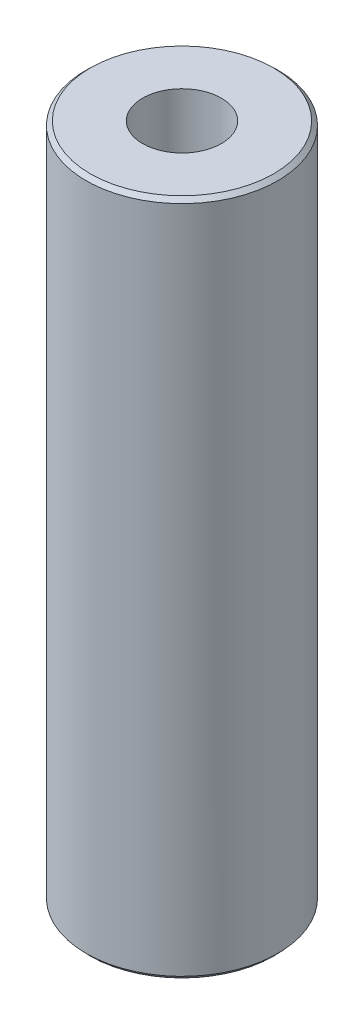
from build123d import *
from OCP.BRepFilletAPI import BRepFilletAPI_MakeChamfer

# Parameters (mm, degrees)
SKETCH1_R           = 45
BOSS_EXTRUDE1_DEPTH = 317.914214539
SKETCH2_R           = 18.498550356
CUT_EXTRUDE1_DEPTH  = 325.221294498
CHAMFER1_SIZE       = 1.83476939
CHAMFER1_SIZE2      = 1.957683998


with BuildPart() as part:
    # Sketch1 → Boss-Extrude1 (new body)
    with BuildSketch(Plane(origin=(0, 0, 0), x_dir=(1, 0, 0), z_dir=(0, 1, 0))):
        Circle(SKETCH1_R)
    extrude(amount=BOSS_EXTRUDE1_DEPTH)

    # Sketch2 → Cut-Extrude1 (cut, through all)
    with BuildSketch(Plane(origin=(0, 0, 0), x_dir=(1, 0, 0), z_dir=(0, 1, 0))):
        Circle(SKETCH2_R)
    extrude(amount=CUT_EXTRUDE1_DEPTH, mode=Mode.SUBTRACT)

    # Chamfer1: one chamfer whose edges measure the first distance from different faces: ONE call of the kernel's chamfer builder (chamfer() names one face for all edges)
    chamfer1_edges_1 = [part.edges().sort_by_distance(p)[0] for p in [
        (-45, 317.914214539, 0),
    ]]
    chamfer1_side_1 = [part.faces().sort_by_distance(p)[0] for p in [
        (-45, 158.957107269, 0),
    ]]
    chamfer1_edges_2 = [part.edges().sort_by_distance(p)[0] for p in [
        (-45, 0, 0),
    ]]
    chamfer1_side_2 = [part.faces().sort_by_distance(p)[0] for p in [
        (-43.727207794, 0, 0),
    ]]
    chamfer1 = BRepFilletAPI_MakeChamfer(part.part.solid().wrapped)
    for e in chamfer1_edges_1:
        chamfer1.Add(CHAMFER1_SIZE, CHAMFER1_SIZE2, e.wrapped, chamfer1_side_1[0].wrapped)  # the first distance lies on this face
    for e in chamfer1_edges_2:
        chamfer1.Add(CHAMFER1_SIZE, CHAMFER1_SIZE2, e.wrapped, chamfer1_side_2[0].wrapped)  # the first distance lies on this face
    add(Compound.cast(chamfer1.Shape()), mode=Mode.REPLACE)


solid = part.part
